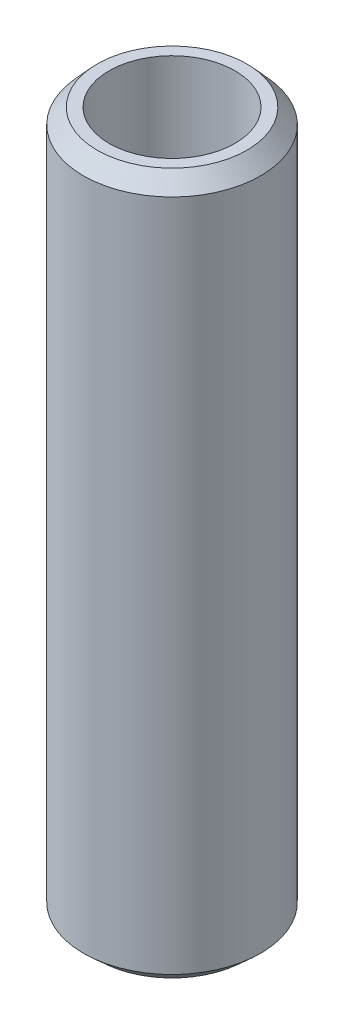
from build123d import *
from OCP.BRepFilletAPI import BRepFilletAPI_MakeChamfer

# Parameters (mm, degrees)
SKETCH1_R           = 25
BOSS_EXTRUDE1_DEPTH = 198.114677756
SKETCH2_R           = 17.757247235
CUT_EXTRUDE1_DEPTH  = 202.244690719
CHAMFER1_SIZE       = 4.292582673
CHAMFER1_SIZE2      = 3.893842901


with BuildPart() as part:
    # Sketch1 → Boss-Extrude1 (new body)
    with BuildSketch(Plane(origin=(0, 0, 0), x_dir=(1, 0, 0), z_dir=(0, 1, 0))):
        Circle(SKETCH1_R)
    extrude(amount=BOSS_EXTRUDE1_DEPTH)

    # Sketch2 → Cut-Extrude1 (cut, through all)
    with BuildSketch(Plane(origin=(0, 0, 0), x_dir=(1, 0, 0), z_dir=(0, 1, 0))):
        Circle(SKETCH2_R)
    extrude(amount=CUT_EXTRUDE1_DEPTH, mode=Mode.SUBTRACT)

    # Chamfer1: one chamfer whose edges measure the first distance from different faces: ONE call of the kernel's chamfer builder (chamfer() names one face for all edges)
    chamfer1_edges_1 = [part.edges().sort_by_distance(p)[0] for p in [
        (-25, 198.114677756, 0),
    ]]
    chamfer1_side_1 = [part.faces().sort_by_distance(p)[0] for p in [
        (-25, 99.057338878, 0),
    ]]
    chamfer1_edges_2 = [part.edges().sort_by_distance(p)[0] for p in [
        (-25, 0, 0),
    ]]
    chamfer1_side_2 = [part.faces().sort_by_distance(p)[0] for p in [
        (-24.292893219, 0, 0),
    ]]
    chamfer1 = BRepFilletAPI_MakeChamfer(part.part.solid().wrapped)
    for e in chamfer1_edges_1:
        chamfer1.Add(CHAMFER1_SIZE, CHAMFER1_SIZE2, e.wrapped, chamfer1_side_1[0].wrapped)  # the first distance lies on this face
    for e in chamfer1_edges_2:
        chamfer1.Add(CHAMFER1_SIZE, CHAMFER1_SIZE2, e.wrapped, chamfer1_side_2[0].wrapped)  # the first distance lies on this face
    add(Compound.cast(chamfer1.Shape()), mode=Mode.REPLACE)


solid = part.part
